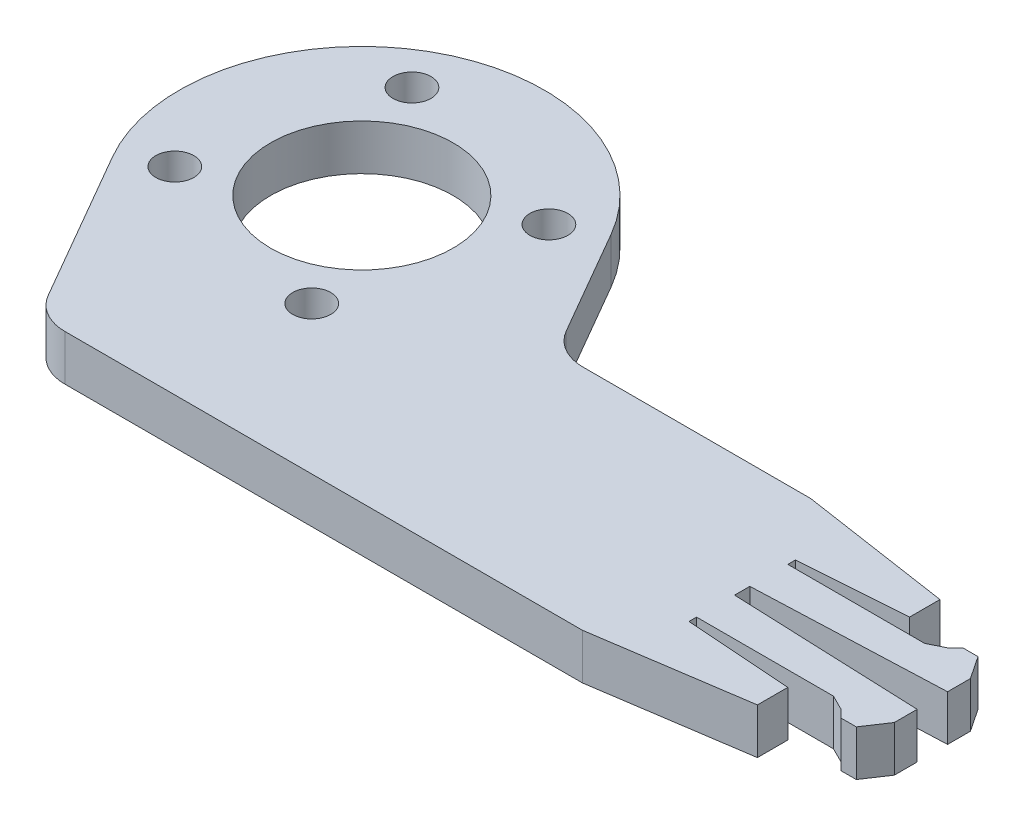
from build123d import *

# Parameters (mm, degrees)
SKETCH1_R           = 1.25
SKETCH1_R_2         = 6
BOSS_EXTRUDE1_DEPTH = 1.5
FILLET1_R           = 3


with BuildPart() as part:
    # Sketch1 → Boss-Extrude1 (new, symmetric)
    with BuildSketch(Plane(origin=(0, 0, 0), x_dir=(1, 0, 0), z_dir=(0, 1, 0))):
        with BuildLine():
            Line((15.299782134, -2.5), (10.392304845, 6))
            ThreePointArc((10.392304845, 6), (-6, 10.392304845), (-10.392304845, -6))
            Line((-10.392304845, -6), (-3.75277675, -17.5))
            Line((-3.75277675, -17.5), (32, -17.5))
            Line((32, -17.5), (42, -16))
            Line((42, -16), (42, -14))
            Line((42, -14), (35, -13.5))
            Line((35, -13.5), (35, -13))
            Line((35, -13), (44, -13))
            Line((44, -13), (45, -13.5))
            Line((45, -13.5), (45.5, -14))
            Line((45.5, -14), (46.5, -14))
            Line((46.5, -14), (47.5, -12.5))
            Line((47.5, -12.5), (47.5, -11))
            Line((47.5, -11), (35, -10.5))
            Line((35, -10.5), (35, -9.5))
            Line((35, -9.5), (47.5, -9))
            Line((47.5, -9), (47.5, -7.5))
            Line((47.5, -7.5), (46.5, -6))
            Line((46.5, -6), (45.5, -6))
            Line((45.5, -6), (45, -6.5))
            Line((45, -6.5), (44, -7))
            Line((44, -7), (35, -7))
            Line((35, -7), (35, -6.5))
            Line((35, -6.5), (42, -6))
            Line((42, -6), (42, -4))
            Line((42, -4), (32, -2.5))
            Line((32, -2.5), (15.299782134, -2.5))
        make_face()
        with Locations((-7.794228634, -4.5)):
            Circle(SKETCH1_R, mode=Mode.SUBTRACT)
        with Locations((4.5, -7.794228634)):
            Circle(SKETCH1_R, mode=Mode.SUBTRACT)
        Circle(SKETCH1_R_2, mode=Mode.SUBTRACT)
        with Locations((7.794228634, 4.5)):
            Circle(SKETCH1_R, mode=Mode.SUBTRACT)
        with Locations((-4.5, 7.794228634)):
            Circle(SKETCH1_R, mode=Mode.SUBTRACT)
    extrude(amount=BOSS_EXTRUDE1_DEPTH, both=True)

    # Fillet1
    fillet1_edges = [part.edges().sort_by_distance(p)[0] for p in [
        (15.299782134, 0, 2.5),
        (-3.75277675, 0, 17.5),
    ]]
    fillet(fillet1_edges, radius=FILLET1_R)


solid = part.part
